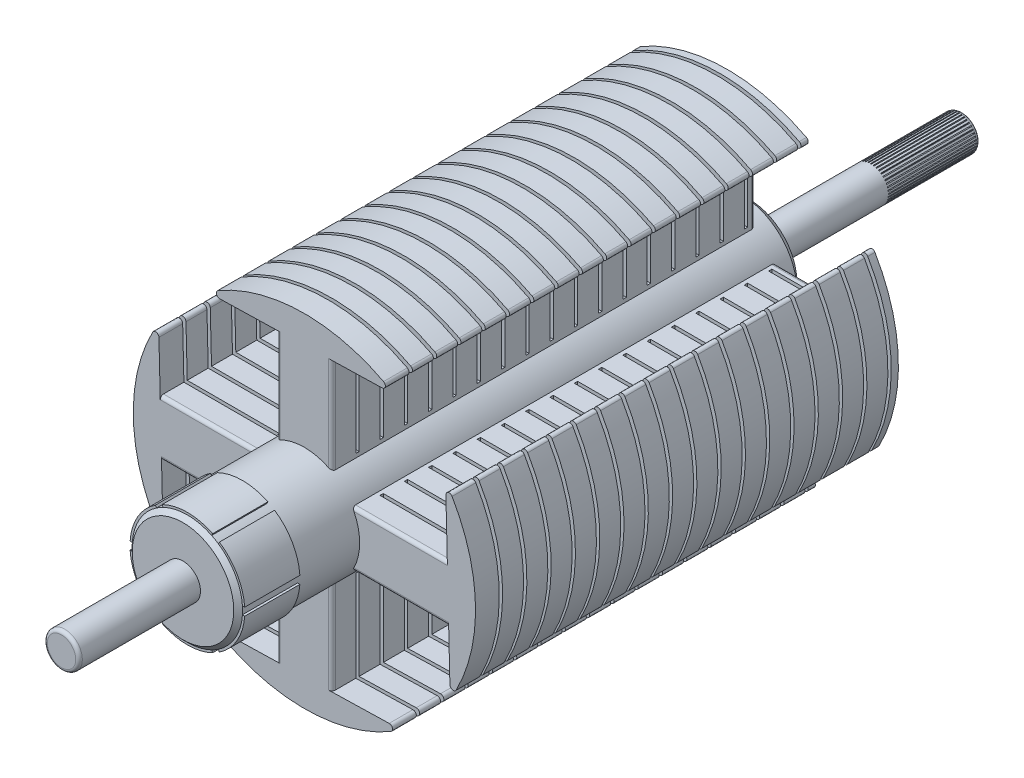
from build123d import *
from build123d.topology import SkipClean

# Parameters (mm, degrees)
BOSS_EXTRUDE1_DEPTH          = 38.3
FILLET1_R                    = 0.3
SKETCH2_W                    = 20
SKETCH2_H                    = 14
CUT_EXTRUDE1_DEPTH           = 0.3
LPATTERN1_COUNT              = 19
LPATTERN1_PITCH              = 2.2
CIRPATTERN1_COUNT            = 4
CIRPATTERN1_COPY_1_SKETCH_W  = 20
CIRPATTERN1_COPY_1_SKETCH_H  = 14
CIRPATTERN1_COPY_1_DEPTH     = 0.3
CIRPATTERN1_COPY_2_SKETCH_W  = 20
CIRPATTERN1_COPY_2_SKETCH_H  = 14
CIRPATTERN1_COPY_2_DEPTH     = 0.3
CIRPATTERN1_COPY_3_SKETCH_W  = 20
CIRPATTERN1_COPY_3_SKETCH_H  = 14
CIRPATTERN1_COPY_3_DEPTH     = 0.3
CIRPATTERN1_COPY_4_SKETCH_W  = 20
CIRPATTERN1_COPY_4_SKETCH_H  = 14
CIRPATTERN1_COPY_4_DEPTH     = 0.3
CIRPATTERN1_COPY_5_SKETCH_W  = 20
CIRPATTERN1_COPY_5_SKETCH_H  = 14
CIRPATTERN1_COPY_5_DEPTH     = 0.3
CIRPATTERN1_COPY_6_SKETCH_W  = 20
CIRPATTERN1_COPY_6_SKETCH_H  = 14
CIRPATTERN1_COPY_6_DEPTH     = 0.3
CIRPATTERN1_COPY_7_SKETCH_W  = 20
CIRPATTERN1_COPY_7_SKETCH_H  = 14
CIRPATTERN1_COPY_7_DEPTH     = 0.3
CIRPATTERN1_COPY_8_SKETCH_W  = 20
CIRPATTERN1_COPY_8_SKETCH_H  = 14
CIRPATTERN1_COPY_8_DEPTH     = 0.3
CIRPATTERN1_COPY_9_SKETCH_W  = 20
CIRPATTERN1_COPY_9_SKETCH_H  = 14
CIRPATTERN1_COPY_9_DEPTH     = 0.3
CIRPATTERN1_COPY_10_SKETCH_W = 20
CIRPATTERN1_COPY_10_SKETCH_H = 14
CIRPATTERN1_COPY_10_DEPTH    = 0.3
CIRPATTERN1_COPY_11_SKETCH_W = 20
CIRPATTERN1_COPY_11_SKETCH_H = 14
CIRPATTERN1_COPY_11_DEPTH    = 0.3
CIRPATTERN1_COPY_12_SKETCH_W = 20
CIRPATTERN1_COPY_12_SKETCH_H = 14
CIRPATTERN1_COPY_12_DEPTH    = 0.3
CIRPATTERN1_COPY_13_SKETCH_W = 20
CIRPATTERN1_COPY_13_SKETCH_H = 14
CIRPATTERN1_COPY_13_DEPTH    = 0.3
CIRPATTERN1_COPY_14_SKETCH_W = 20
CIRPATTERN1_COPY_14_SKETCH_H = 14
CIRPATTERN1_COPY_14_DEPTH    = 0.3
CIRPATTERN1_COPY_15_SKETCH_W = 20
CIRPATTERN1_COPY_15_SKETCH_H = 14
CIRPATTERN1_COPY_15_DEPTH    = 0.3
CIRPATTERN1_COPY_16_SKETCH_W = 20
CIRPATTERN1_COPY_16_SKETCH_H = 14
CIRPATTERN1_COPY_16_DEPTH    = 0.3
CIRPATTERN1_COPY_17_SKETCH_W = 20
CIRPATTERN1_COPY_17_SKETCH_H = 14
CIRPATTERN1_COPY_17_DEPTH    = 0.3
CIRPATTERN1_COPY_18_SKETCH_W = 20
CIRPATTERN1_COPY_18_SKETCH_H = 14
CIRPATTERN1_COPY_18_DEPTH    = 0.3
CIRPATTERN1_COPY_19_SKETCH_W = 20
CIRPATTERN1_COPY_19_SKETCH_H = 14
CIRPATTERN1_COPY_19_DEPTH    = 0.3
CIRPATTERN1_COPY_20_SKETCH_W = 20
CIRPATTERN1_COPY_20_SKETCH_H = 14
CIRPATTERN1_COPY_20_DEPTH    = 0.3
CIRPATTERN1_COPY_21_SKETCH_W = 20
CIRPATTERN1_COPY_21_SKETCH_H = 14
CIRPATTERN1_COPY_21_DEPTH    = 0.3
CIRPATTERN1_COPY_22_SKETCH_W = 20
CIRPATTERN1_COPY_22_SKETCH_H = 14
CIRPATTERN1_COPY_22_DEPTH    = 0.3
CIRPATTERN1_COPY_23_SKETCH_W = 20
CIRPATTERN1_COPY_23_SKETCH_H = 14
CIRPATTERN1_COPY_23_DEPTH    = 0.3
CIRPATTERN1_COPY_24_SKETCH_W = 20
CIRPATTERN1_COPY_24_SKETCH_H = 14
CIRPATTERN1_COPY_24_DEPTH    = 0.3
CIRPATTERN1_COPY_25_SKETCH_W = 20
CIRPATTERN1_COPY_25_SKETCH_H = 14
CIRPATTERN1_COPY_25_DEPTH    = 0.3
CIRPATTERN1_COPY_26_SKETCH_W = 20
CIRPATTERN1_COPY_26_SKETCH_H = 14
CIRPATTERN1_COPY_26_DEPTH    = 0.3
CIRPATTERN1_COPY_27_SKETCH_W = 20
CIRPATTERN1_COPY_27_SKETCH_H = 14
CIRPATTERN1_COPY_27_DEPTH    = 0.3
CIRPATTERN1_COPY_28_SKETCH_W = 20
CIRPATTERN1_COPY_28_SKETCH_H = 14
CIRPATTERN1_COPY_28_DEPTH    = 0.3
CIRPATTERN1_COPY_29_SKETCH_W = 20
CIRPATTERN1_COPY_29_SKETCH_H = 14
CIRPATTERN1_COPY_29_DEPTH    = 0.3
CIRPATTERN1_COPY_30_SKETCH_W = 20
CIRPATTERN1_COPY_30_SKETCH_H = 14
CIRPATTERN1_COPY_30_DEPTH    = 0.3
CIRPATTERN1_COPY_31_SKETCH_W = 20
CIRPATTERN1_COPY_31_SKETCH_H = 14
CIRPATTERN1_COPY_31_DEPTH    = 0.3
CIRPATTERN1_COPY_32_SKETCH_W = 20
CIRPATTERN1_COPY_32_SKETCH_H = 14
CIRPATTERN1_COPY_32_DEPTH    = 0.3
CIRPATTERN1_COPY_33_SKETCH_W = 20
CIRPATTERN1_COPY_33_SKETCH_H = 14
CIRPATTERN1_COPY_33_DEPTH    = 0.3
CIRPATTERN1_COPY_34_SKETCH_W = 20
CIRPATTERN1_COPY_34_SKETCH_H = 14
CIRPATTERN1_COPY_34_DEPTH    = 0.3
CIRPATTERN1_COPY_35_SKETCH_W = 20
CIRPATTERN1_COPY_35_SKETCH_H = 14
CIRPATTERN1_COPY_35_DEPTH    = 0.3
CIRPATTERN1_COPY_36_SKETCH_W = 20
CIRPATTERN1_COPY_36_SKETCH_H = 14
CIRPATTERN1_COPY_36_DEPTH    = 0.3
CIRPATTERN1_COPY_37_SKETCH_W = 20
CIRPATTERN1_COPY_37_SKETCH_H = 14
CIRPATTERN1_COPY_37_DEPTH    = 0.3
CIRPATTERN1_COPY_38_SKETCH_W = 20
CIRPATTERN1_COPY_38_SKETCH_H = 14
CIRPATTERN1_COPY_38_DEPTH    = 0.3
CIRPATTERN1_COPY_39_SKETCH_W = 20
CIRPATTERN1_COPY_39_SKETCH_H = 14
CIRPATTERN1_COPY_39_DEPTH    = 0.3
CIRPATTERN1_COPY_40_SKETCH_W = 20
CIRPATTERN1_COPY_40_SKETCH_H = 14
CIRPATTERN1_COPY_40_DEPTH    = 0.3
CIRPATTERN1_COPY_41_SKETCH_W = 20
CIRPATTERN1_COPY_41_SKETCH_H = 14
CIRPATTERN1_COPY_41_DEPTH    = 0.3
CIRPATTERN1_COPY_42_SKETCH_W = 20
CIRPATTERN1_COPY_42_SKETCH_H = 14
CIRPATTERN1_COPY_42_DEPTH    = 0.3
CIRPATTERN1_COPY_43_SKETCH_W = 20
CIRPATTERN1_COPY_43_SKETCH_H = 14
CIRPATTERN1_COPY_43_DEPTH    = 0.3
CIRPATTERN1_COPY_44_SKETCH_W = 20
CIRPATTERN1_COPY_44_SKETCH_H = 14
CIRPATTERN1_COPY_44_DEPTH    = 0.3
CIRPATTERN1_COPY_45_SKETCH_W = 20
CIRPATTERN1_COPY_45_SKETCH_H = 14
CIRPATTERN1_COPY_45_DEPTH    = 0.3
CIRPATTERN1_COPY_46_SKETCH_W = 20
CIRPATTERN1_COPY_46_SKETCH_H = 14
CIRPATTERN1_COPY_46_DEPTH    = 0.3
CIRPATTERN1_COPY_47_SKETCH_W = 20
CIRPATTERN1_COPY_47_SKETCH_H = 14
CIRPATTERN1_COPY_47_DEPTH    = 0.3
CIRPATTERN1_COPY_48_SKETCH_W = 20
CIRPATTERN1_COPY_48_SKETCH_H = 14
CIRPATTERN1_COPY_48_DEPTH    = 0.3
CIRPATTERN1_COPY_49_SKETCH_W = 20
CIRPATTERN1_COPY_49_SKETCH_H = 14
CIRPATTERN1_COPY_49_DEPTH    = 0.3
CIRPATTERN1_COPY_50_SKETCH_W = 20
CIRPATTERN1_COPY_50_SKETCH_H = 14
CIRPATTERN1_COPY_50_DEPTH    = 0.3
CIRPATTERN1_COPY_51_SKETCH_W = 20
CIRPATTERN1_COPY_51_SKETCH_H = 14
CIRPATTERN1_COPY_51_DEPTH    = 0.3
CIRPATTERN1_COPY_52_SKETCH_W = 20
CIRPATTERN1_COPY_52_SKETCH_H = 14
CIRPATTERN1_COPY_52_DEPTH    = 0.3
CIRPATTERN1_COPY_53_SKETCH_W = 20
CIRPATTERN1_COPY_53_SKETCH_H = 14
CIRPATTERN1_COPY_53_DEPTH    = 0.3
CIRPATTERN1_COPY_54_SKETCH_W = 20
CIRPATTERN1_COPY_54_SKETCH_H = 14
CIRPATTERN1_COPY_54_DEPTH    = 0.3
BOSS_EXTRUDE2_START          = 2
SKETCH3_R                    = 5
BOSS_EXTRUDE2_DEPTH          = 2
CHAMFER1_SIZE                = 0.7
SKETCH4_R                    = 1.585
BOSS_EXTRUDE3_DEPTH          = 19.3
FILLET2_R                    = 0.3
SKETCH5_R                    = 5
BOSS_EXTRUDE4_DEPTH          = 11
CHAMFER2_SIZE                = 0.4
BOSS_EXTRUDE6_START          = -5
BOSS_EXTRUDE6_DEPTH          = 5
SKETCH9_W                    = 0.08
SKETCH9_H                    = 0.4
SKETCH9_W_2                  = 0.4
SKETCH9_H_2                  = 0.08
CUT_EXTRUDE2_DEPTH           = 8
BOSS_EXTRUDE7_START          = 11
SKETCH10_R                   = 1.585
BOSS_EXTRUDE7_DEPTH          = 11
FILLET3_R                    = 0.3


with BuildPart() as part:
    # Sketch1 → Boss-Extrude1 (new body)
    with BuildSketch(Plane.XY):
        with BuildLine():
            Line((-8.758733901, 12.788063983), (-2.5, 12.942328551))
            Line((-2.5, 12.942328551), (-2.5, 4.330127019))
            ThreePointArc((-2.5, 4.330127019), (-3.535533906, 3.535533906), (-4.330127019, 2.5))
            Line((-4.330127019, 2.5), (-13.065567988, 2.5))
            Line((-13.065567988, 2.5), (-13.204041875, 8.118083405))
            ThreePointArc((-13.204041875, 8.118083405), (-15.495293877, -0.381926258), (-12.788063983, -8.758733901))
            Line((-12.788063983, -8.758733901), (-12.942328551, -2.5))
            Line((-12.942328551, -2.5), (-4.330127019, -2.5))
            ThreePointArc((-4.330127019, -2.5), (-3.535533906, -3.535533906), (-2.5, -4.330127019))
            Line((-2.5, -4.330127019), (-2.5, -13.065567988))
            Line((-2.5, -13.065567988), (-8.118083405, -13.204041875))
            ThreePointArc((-8.118083405, -13.204041875), (0.381926258, -15.495293877), (8.758733901, -12.788063983))
            Line((8.758733901, -12.788063983), (2.5, -12.942328551))
            Line((2.5, -12.942328551), (2.5, -4.330127019))
            ThreePointArc((2.5, -4.330127019), (3.535533906, -3.535533906), (4.330127019, -2.5))
            Line((4.330127019, -2.5), (13.065567988, -2.5))
            Line((13.065567988, -2.5), (13.204041875, -8.118083405))
            ThreePointArc((13.204041875, -8.118083405), (15.495293877, 0.381926258), (12.788063983, 8.758733901))
            Line((12.788063983, 8.758733901), (12.942328551, 2.5))
            Line((12.942328551, 2.5), (4.330127019, 2.5))
            ThreePointArc((4.330127019, 2.5), (3.535533906, 3.535533906), (2.5, 4.330127019))
            Line((2.5, 4.330127019), (2.5, 13.065567988))
            Line((2.5, 13.065567988), (8.118083405, 13.204041875))
            ThreePointArc((8.118083405, 13.204041875), (-0.381926258, 15.495293877), (-8.758733901, 12.788063983))
        make_face()
    extrude(amount=BOSS_EXTRUDE1_DEPTH)

    # Fillet1
    fillet1_edges = [part.edges().sort_by_distance(p)[0] for p in [
        (8.636227785, 2.5, 0),
        (8.697847503, -2.5, 0),
        (2.5, -8.636227785, 0),
        (-2.5, -8.697847503, 0),
        (-8.636227785, -2.5, 0),
        (-8.697847503, 2.5, 0),
        (13.204041875, -8.118083405, 19.15),
        (8.758733901, -12.788063983, 19.15),
        (-8.118083405, -13.204041875, 19.15),
        (-12.788063983, -8.758733901, 19.15),
        (-13.204041875, 8.118083405, 19.15),
        (-8.697847503, 2.5, 38.3),
        (-8.636227785, -2.5, 38.3),
        (-2.5, -8.697847503, 38.3),
        (2.5, -8.636227785, 38.3),
        (8.697847503, -2.5, 38.3),
        (8.636227785, 2.5, 38.3),
        (12.788063983, 8.758733901, 19.15),
        (2.5, 8.697847503, 0),
        (-2.5, 8.636227785, 0),
        (-8.758733901, 12.788063983, 19.15),
        (8.118083405, 13.204041875, 19.15),
        (-2.5, 8.636227785, 38.3),
        (2.5, 8.697847503, 38.3),
    ]]
    fillet(fillet1_edges, radius=FILLET1_R)

    # Sketch2 → Cut-Extrude1 (cut)
    with BuildSketch(Plane.XY.offset(36.15)):
        with Locations((0, 11.692424815)):
            Rectangle(SKETCH2_W, SKETCH2_H)
    cut_extrude1 = extrude(amount=-CUT_EXTRUDE1_DEPTH, mode=Mode.SUBTRACT)

    # LPattern1: Cut-Extrude1 ×19
    with Locations(*[(0, 0, -i * LPATTERN1_PITCH) for i in range(1, LPATTERN1_COUNT)]):
        add(cut_extrude1, mode=Mode.SUBTRACT)

    # CirPattern1: Cut-Extrude1 ×4 about axis
    cirpattern1_axis = Axis((0, 0, 38.3), (0, 0, -1))
    for i in range(1, CIRPATTERN1_COUNT):
        add(cut_extrude1.rotate(cirpattern1_axis, i * 360 / CIRPATTERN1_COUNT), mode=Mode.SUBTRACT)

    # CirPattern1 copy 1 sketch → CirPattern1 copy 1 (cut)
    with BuildSketch(Plane(origin=(0, 0, 33.95), x_dir=(0, -1, 0), z_dir=(0, 0, 1))):
        with Locations((0, 11.692424815)):
            Rectangle(CIRPATTERN1_COPY_1_SKETCH_W, CIRPATTERN1_COPY_1_SKETCH_H)
    extrude(amount=-CIRPATTERN1_COPY_1_DEPTH, mode=Mode.SUBTRACT)

    # CirPattern1 copy 2 sketch → CirPattern1 copy 2 (cut)
    with BuildSketch(Plane(origin=(0, 0, 33.95), x_dir=(-1, 0, 0), z_dir=(0, 0, 1))):
        with Locations((0, 11.692424815)):
            Rectangle(CIRPATTERN1_COPY_2_SKETCH_W, CIRPATTERN1_COPY_2_SKETCH_H)
    extrude(amount=-CIRPATTERN1_COPY_2_DEPTH, mode=Mode.SUBTRACT)

    # CirPattern1 copy 3 sketch → CirPattern1 copy 3 (cut)
    with BuildSketch(Plane(origin=(0, 0, 33.95), x_dir=(0, 1, 0), z_dir=(0, 0, 1))):
        with Locations((0, 11.692424815)):
            Rectangle(CIRPATTERN1_COPY_3_SKETCH_W, CIRPATTERN1_COPY_3_SKETCH_H)
    extrude(amount=-CIRPATTERN1_COPY_3_DEPTH, mode=Mode.SUBTRACT)

    # CirPattern1 copy 4 sketch → CirPattern1 copy 4 (cut)
    with BuildSketch(Plane(origin=(0, 0, 31.75), x_dir=(0, -1, 0), z_dir=(0, 0, 1))):
        with Locations((0, 11.692424815)):
            Rectangle(CIRPATTERN1_COPY_4_SKETCH_W, CIRPATTERN1_COPY_4_SKETCH_H)
    extrude(amount=-CIRPATTERN1_COPY_4_DEPTH, mode=Mode.SUBTRACT)

    # CirPattern1 copy 5 sketch → CirPattern1 copy 5 (cut)
    with BuildSketch(Plane(origin=(0, 0, 31.75), x_dir=(-1, 0, 0), z_dir=(0, 0, 1))):
        with Locations((0, 11.692424815)):
            Rectangle(CIRPATTERN1_COPY_5_SKETCH_W, CIRPATTERN1_COPY_5_SKETCH_H)
    extrude(amount=-CIRPATTERN1_COPY_5_DEPTH, mode=Mode.SUBTRACT)

    # CirPattern1 copy 6 sketch → CirPattern1 copy 6 (cut)
    with BuildSketch(Plane(origin=(0, 0, 31.75), x_dir=(0, 1, 0), z_dir=(0, 0, 1))):
        with Locations((0, 11.692424815)):
            Rectangle(CIRPATTERN1_COPY_6_SKETCH_W, CIRPATTERN1_COPY_6_SKETCH_H)
    extrude(amount=-CIRPATTERN1_COPY_6_DEPTH, mode=Mode.SUBTRACT)

    # CirPattern1 copy 7 sketch → CirPattern1 copy 7 (cut)
    with BuildSketch(Plane(origin=(0, 0, 29.55), x_dir=(0, -1, 0), z_dir=(0, 0, 1))):
        with Locations((0, 11.692424815)):
            Rectangle(CIRPATTERN1_COPY_7_SKETCH_W, CIRPATTERN1_COPY_7_SKETCH_H)
    extrude(amount=-CIRPATTERN1_COPY_7_DEPTH, mode=Mode.SUBTRACT)

    # CirPattern1 copy 8 sketch → CirPattern1 copy 8 (cut)
    with BuildSketch(Plane(origin=(0, 0, 29.55), x_dir=(-1, 0, 0), z_dir=(0, 0, 1))):
        with Locations((0, 11.692424815)):
            Rectangle(CIRPATTERN1_COPY_8_SKETCH_W, CIRPATTERN1_COPY_8_SKETCH_H)
    extrude(amount=-CIRPATTERN1_COPY_8_DEPTH, mode=Mode.SUBTRACT)

    # CirPattern1 copy 9 sketch → CirPattern1 copy 9 (cut)
    with BuildSketch(Plane(origin=(0, 0, 29.55), x_dir=(0, 1, 0), z_dir=(0, 0, 1))):
        with Locations((0, 11.692424815)):
            Rectangle(CIRPATTERN1_COPY_9_SKETCH_W, CIRPATTERN1_COPY_9_SKETCH_H)
    extrude(amount=-CIRPATTERN1_COPY_9_DEPTH, mode=Mode.SUBTRACT)

    # CirPattern1 copy 10 sketch → CirPattern1 copy 10 (cut)
    with BuildSketch(Plane(origin=(0, 0, 27.35), x_dir=(0, -1, 0), z_dir=(0, 0, 1))):
        with Locations((0, 11.692424815)):
            Rectangle(CIRPATTERN1_COPY_10_SKETCH_W, CIRPATTERN1_COPY_10_SKETCH_H)
    extrude(amount=-CIRPATTERN1_COPY_10_DEPTH, mode=Mode.SUBTRACT)

    # CirPattern1 copy 11 sketch → CirPattern1 copy 11 (cut)
    with BuildSketch(Plane(origin=(0, 0, 27.35), x_dir=(-1, 0, 0), z_dir=(0, 0, 1))):
        with Locations((0, 11.692424815)):
            Rectangle(CIRPATTERN1_COPY_11_SKETCH_W, CIRPATTERN1_COPY_11_SKETCH_H)
    extrude(amount=-CIRPATTERN1_COPY_11_DEPTH, mode=Mode.SUBTRACT)

    # CirPattern1 copy 12 sketch → CirPattern1 copy 12 (cut)
    with BuildSketch(Plane(origin=(0, 0, 27.35), x_dir=(0, 1, 0), z_dir=(0, 0, 1))):
        with Locations((0, 11.692424815)):
            Rectangle(CIRPATTERN1_COPY_12_SKETCH_W, CIRPATTERN1_COPY_12_SKETCH_H)
    extrude(amount=-CIRPATTERN1_COPY_12_DEPTH, mode=Mode.SUBTRACT)

    # CirPattern1 copy 13 sketch → CirPattern1 copy 13 (cut)
    with BuildSketch(Plane(origin=(0, 0, 25.15), x_dir=(0, -1, 0), z_dir=(0, 0, 1))):
        with Locations((0, 11.692424815)):
            Rectangle(CIRPATTERN1_COPY_13_SKETCH_W, CIRPATTERN1_COPY_13_SKETCH_H)
    extrude(amount=-CIRPATTERN1_COPY_13_DEPTH, mode=Mode.SUBTRACT)

    # CirPattern1 copy 14 sketch → CirPattern1 copy 14 (cut)
    with BuildSketch(Plane(origin=(0, 0, 25.15), x_dir=(-1, 0, 0), z_dir=(0, 0, 1))):
        with Locations((0, 11.692424815)):
            Rectangle(CIRPATTERN1_COPY_14_SKETCH_W, CIRPATTERN1_COPY_14_SKETCH_H)
    extrude(amount=-CIRPATTERN1_COPY_14_DEPTH, mode=Mode.SUBTRACT)

    # CirPattern1 copy 15 sketch → CirPattern1 copy 15 (cut)
    with BuildSketch(Plane(origin=(0, 0, 25.15), x_dir=(0, 1, 0), z_dir=(0, 0, 1))):
        with Locations((0, 11.692424815)):
            Rectangle(CIRPATTERN1_COPY_15_SKETCH_W, CIRPATTERN1_COPY_15_SKETCH_H)
    extrude(amount=-CIRPATTERN1_COPY_15_DEPTH, mode=Mode.SUBTRACT)

    # CirPattern1 copy 16 sketch → CirPattern1 copy 16 (cut)
    with BuildSketch(Plane(origin=(0, 0, 22.95), x_dir=(0, -1, 0), z_dir=(0, 0, 1))):
        with Locations((0, 11.692424815)):
            Rectangle(CIRPATTERN1_COPY_16_SKETCH_W, CIRPATTERN1_COPY_16_SKETCH_H)
    extrude(amount=-CIRPATTERN1_COPY_16_DEPTH, mode=Mode.SUBTRACT)

    # CirPattern1 copy 17 sketch → CirPattern1 copy 17 (cut)
    with BuildSketch(Plane(origin=(0, 0, 22.95), x_dir=(-1, 0, 0), z_dir=(0, 0, 1))):
        with Locations((0, 11.692424815)):
            Rectangle(CIRPATTERN1_COPY_17_SKETCH_W, CIRPATTERN1_COPY_17_SKETCH_H)
    extrude(amount=-CIRPATTERN1_COPY_17_DEPTH, mode=Mode.SUBTRACT)

    # CirPattern1 copy 18 sketch → CirPattern1 copy 18 (cut)
    with BuildSketch(Plane(origin=(0, 0, 22.95), x_dir=(0, 1, 0), z_dir=(0, 0, 1))):
        with Locations((0, 11.692424815)):
            Rectangle(CIRPATTERN1_COPY_18_SKETCH_W, CIRPATTERN1_COPY_18_SKETCH_H)
    extrude(amount=-CIRPATTERN1_COPY_18_DEPTH, mode=Mode.SUBTRACT)

    # CirPattern1 copy 19 sketch → CirPattern1 copy 19 (cut)
    with BuildSketch(Plane(origin=(0, 0, 20.75), x_dir=(0, -1, 0), z_dir=(0, 0, 1))):
        with Locations((0, 11.692424815)):
            Rectangle(CIRPATTERN1_COPY_19_SKETCH_W, CIRPATTERN1_COPY_19_SKETCH_H)
    extrude(amount=-CIRPATTERN1_COPY_19_DEPTH, mode=Mode.SUBTRACT)

    # CirPattern1 copy 20 sketch → CirPattern1 copy 20 (cut)
    with BuildSketch(Plane(origin=(0, 0, 20.75), x_dir=(-1, 0, 0), z_dir=(0, 0, 1))):
        with Locations((0, 11.692424815)):
            Rectangle(CIRPATTERN1_COPY_20_SKETCH_W, CIRPATTERN1_COPY_20_SKETCH_H)
    extrude(amount=-CIRPATTERN1_COPY_20_DEPTH, mode=Mode.SUBTRACT)

    # CirPattern1 copy 21 sketch → CirPattern1 copy 21 (cut)
    with BuildSketch(Plane(origin=(0, 0, 20.75), x_dir=(0, 1, 0), z_dir=(0, 0, 1))):
        with Locations((0, 11.692424815)):
            Rectangle(CIRPATTERN1_COPY_21_SKETCH_W, CIRPATTERN1_COPY_21_SKETCH_H)
    extrude(amount=-CIRPATTERN1_COPY_21_DEPTH, mode=Mode.SUBTRACT)

    # CirPattern1 copy 22 sketch → CirPattern1 copy 22 (cut)
    with BuildSketch(Plane(origin=(0, 0, 18.55), x_dir=(0, -1, 0), z_dir=(0, 0, 1))):
        with Locations((0, 11.692424815)):
            Rectangle(CIRPATTERN1_COPY_22_SKETCH_W, CIRPATTERN1_COPY_22_SKETCH_H)
    extrude(amount=-CIRPATTERN1_COPY_22_DEPTH, mode=Mode.SUBTRACT)

    # CirPattern1 copy 23 sketch → CirPattern1 copy 23 (cut)
    with BuildSketch(Plane(origin=(0, 0, 18.55), x_dir=(-1, 0, 0), z_dir=(0, 0, 1))):
        with Locations((0, 11.692424815)):
            Rectangle(CIRPATTERN1_COPY_23_SKETCH_W, CIRPATTERN1_COPY_23_SKETCH_H)
    extrude(amount=-CIRPATTERN1_COPY_23_DEPTH, mode=Mode.SUBTRACT)

    # CirPattern1 copy 24 sketch → CirPattern1 copy 24 (cut)
    with BuildSketch(Plane(origin=(0, 0, 18.55), x_dir=(0, 1, 0), z_dir=(0, 0, 1))):
        with Locations((0, 11.692424815)):
            Rectangle(CIRPATTERN1_COPY_24_SKETCH_W, CIRPATTERN1_COPY_24_SKETCH_H)
    extrude(amount=-CIRPATTERN1_COPY_24_DEPTH, mode=Mode.SUBTRACT)

    # CirPattern1 copy 25 sketch → CirPattern1 copy 25 (cut)
    with BuildSketch(Plane(origin=(0, 0, 16.35), x_dir=(0, -1, 0), z_dir=(0, 0, 1))):
        with Locations((0, 11.692424815)):
            Rectangle(CIRPATTERN1_COPY_25_SKETCH_W, CIRPATTERN1_COPY_25_SKETCH_H)
    extrude(amount=-CIRPATTERN1_COPY_25_DEPTH, mode=Mode.SUBTRACT)

    # CirPattern1 copy 26 sketch → CirPattern1 copy 26 (cut)
    with BuildSketch(Plane(origin=(0, 0, 16.35), x_dir=(-1, 0, 0), z_dir=(0, 0, 1))):
        with Locations((0, 11.692424815)):
            Rectangle(CIRPATTERN1_COPY_26_SKETCH_W, CIRPATTERN1_COPY_26_SKETCH_H)
    extrude(amount=-CIRPATTERN1_COPY_26_DEPTH, mode=Mode.SUBTRACT)

    # CirPattern1 copy 27 sketch → CirPattern1 copy 27 (cut)
    with BuildSketch(Plane(origin=(0, 0, 16.35), x_dir=(0, 1, 0), z_dir=(0, 0, 1))):
        with Locations((0, 11.692424815)):
            Rectangle(CIRPATTERN1_COPY_27_SKETCH_W, CIRPATTERN1_COPY_27_SKETCH_H)
    extrude(amount=-CIRPATTERN1_COPY_27_DEPTH, mode=Mode.SUBTRACT)

    # CirPattern1 copy 28 sketch → CirPattern1 copy 28 (cut)
    with BuildSketch(Plane(origin=(0, 0, 14.15), x_dir=(0, -1, 0), z_dir=(0, 0, 1))):
        with Locations((0, 11.692424815)):
            Rectangle(CIRPATTERN1_COPY_28_SKETCH_W, CIRPATTERN1_COPY_28_SKETCH_H)
    extrude(amount=-CIRPATTERN1_COPY_28_DEPTH, mode=Mode.SUBTRACT)

    # CirPattern1 copy 29 sketch → CirPattern1 copy 29 (cut)
    with BuildSketch(Plane(origin=(0, 0, 14.15), x_dir=(-1, 0, 0), z_dir=(0, 0, 1))):
        with Locations((0, 11.692424815)):
            Rectangle(CIRPATTERN1_COPY_29_SKETCH_W, CIRPATTERN1_COPY_29_SKETCH_H)
    extrude(amount=-CIRPATTERN1_COPY_29_DEPTH, mode=Mode.SUBTRACT)

    # CirPattern1 copy 30 sketch → CirPattern1 copy 30 (cut)
    with BuildSketch(Plane(origin=(0, 0, 14.15), x_dir=(0, 1, 0), z_dir=(0, 0, 1))):
        with Locations((0, 11.692424815)):
            Rectangle(CIRPATTERN1_COPY_30_SKETCH_W, CIRPATTERN1_COPY_30_SKETCH_H)
    extrude(amount=-CIRPATTERN1_COPY_30_DEPTH, mode=Mode.SUBTRACT)

    # CirPattern1 copy 31 sketch → CirPattern1 copy 31 (cut)
    with BuildSketch(Plane(origin=(0, 0, 11.95), x_dir=(0, -1, 0), z_dir=(0, 0, 1))):
        with Locations((0, 11.692424815)):
            Rectangle(CIRPATTERN1_COPY_31_SKETCH_W, CIRPATTERN1_COPY_31_SKETCH_H)
    extrude(amount=-CIRPATTERN1_COPY_31_DEPTH, mode=Mode.SUBTRACT)

    # CirPattern1 copy 32 sketch → CirPattern1 copy 32 (cut)
    with BuildSketch(Plane(origin=(0, 0, 11.95), x_dir=(-1, 0, 0), z_dir=(0, 0, 1))):
        with Locations((0, 11.692424815)):
            Rectangle(CIRPATTERN1_COPY_32_SKETCH_W, CIRPATTERN1_COPY_32_SKETCH_H)
    extrude(amount=-CIRPATTERN1_COPY_32_DEPTH, mode=Mode.SUBTRACT)

    # CirPattern1 copy 33 sketch → CirPattern1 copy 33 (cut)
    with BuildSketch(Plane(origin=(0, 0, 11.95), x_dir=(0, 1, 0), z_dir=(0, 0, 1))):
        with Locations((0, 11.692424815)):
            Rectangle(CIRPATTERN1_COPY_33_SKETCH_W, CIRPATTERN1_COPY_33_SKETCH_H)
    extrude(amount=-CIRPATTERN1_COPY_33_DEPTH, mode=Mode.SUBTRACT)

    # CirPattern1 copy 34 sketch → CirPattern1 copy 34 (cut)
    with BuildSketch(Plane(origin=(0, 0, 9.75), x_dir=(0, -1, 0), z_dir=(0, 0, 1))):
        with Locations((0, 11.692424815)):
            Rectangle(CIRPATTERN1_COPY_34_SKETCH_W, CIRPATTERN1_COPY_34_SKETCH_H)
    extrude(amount=-CIRPATTERN1_COPY_34_DEPTH, mode=Mode.SUBTRACT)

    # CirPattern1 copy 35 sketch → CirPattern1 copy 35 (cut)
    with BuildSketch(Plane(origin=(0, 0, 9.75), x_dir=(-1, 0, 0), z_dir=(0, 0, 1))):
        with Locations((0, 11.692424815)):
            Rectangle(CIRPATTERN1_COPY_35_SKETCH_W, CIRPATTERN1_COPY_35_SKETCH_H)
    extrude(amount=-CIRPATTERN1_COPY_35_DEPTH, mode=Mode.SUBTRACT)

    # CirPattern1 copy 36 sketch → CirPattern1 copy 36 (cut)
    with BuildSketch(Plane(origin=(0, 0, 9.75), x_dir=(0, 1, 0), z_dir=(0, 0, 1))):
        with Locations((0, 11.692424815)):
            Rectangle(CIRPATTERN1_COPY_36_SKETCH_W, CIRPATTERN1_COPY_36_SKETCH_H)
    extrude(amount=-CIRPATTERN1_COPY_36_DEPTH, mode=Mode.SUBTRACT)

    # CirPattern1 copy 37 sketch → CirPattern1 copy 37 (cut)
    with BuildSketch(Plane(origin=(0, 0, 7.55), x_dir=(0, -1, 0), z_dir=(0, 0, 1))):
        with Locations((0, 11.692424815)):
            Rectangle(CIRPATTERN1_COPY_37_SKETCH_W, CIRPATTERN1_COPY_37_SKETCH_H)
    extrude(amount=-CIRPATTERN1_COPY_37_DEPTH, mode=Mode.SUBTRACT)

    # CirPattern1 copy 38 sketch → CirPattern1 copy 38 (cut)
    with BuildSketch(Plane(origin=(0, 0, 7.55), x_dir=(-1, 0, 0), z_dir=(0, 0, 1))):
        with Locations((0, 11.692424815)):
            Rectangle(CIRPATTERN1_COPY_38_SKETCH_W, CIRPATTERN1_COPY_38_SKETCH_H)
    extrude(amount=-CIRPATTERN1_COPY_38_DEPTH, mode=Mode.SUBTRACT)

    # CirPattern1 copy 39 sketch → CirPattern1 copy 39 (cut)
    with BuildSketch(Plane(origin=(0, 0, 7.55), x_dir=(0, 1, 0), z_dir=(0, 0, 1))):
        with Locations((0, 11.692424815)):
            Rectangle(CIRPATTERN1_COPY_39_SKETCH_W, CIRPATTERN1_COPY_39_SKETCH_H)
    extrude(amount=-CIRPATTERN1_COPY_39_DEPTH, mode=Mode.SUBTRACT)

    # CirPattern1 copy 40 sketch → CirPattern1 copy 40 (cut)
    with BuildSketch(Plane(origin=(0, 0, 5.35), x_dir=(0, -1, 0), z_dir=(0, 0, 1))):
        with Locations((0, 11.692424815)):
            Rectangle(CIRPATTERN1_COPY_40_SKETCH_W, CIRPATTERN1_COPY_40_SKETCH_H)
    extrude(amount=-CIRPATTERN1_COPY_40_DEPTH, mode=Mode.SUBTRACT)

    # CirPattern1 copy 41 sketch → CirPattern1 copy 41 (cut)
    with BuildSketch(Plane(origin=(0, 0, 5.35), x_dir=(-1, 0, 0), z_dir=(0, 0, 1))):
        with Locations((0, 11.692424815)):
            Rectangle(CIRPATTERN1_COPY_41_SKETCH_W, CIRPATTERN1_COPY_41_SKETCH_H)
    extrude(amount=-CIRPATTERN1_COPY_41_DEPTH, mode=Mode.SUBTRACT)

    # CirPattern1 copy 42 sketch → CirPattern1 copy 42 (cut)
    with BuildSketch(Plane(origin=(0, 0, 5.35), x_dir=(0, 1, 0), z_dir=(0, 0, 1))):
        with Locations((0, 11.692424815)):
            Rectangle(CIRPATTERN1_COPY_42_SKETCH_W, CIRPATTERN1_COPY_42_SKETCH_H)
    extrude(amount=-CIRPATTERN1_COPY_42_DEPTH, mode=Mode.SUBTRACT)

    # CirPattern1 copy 43 sketch → CirPattern1 copy 43 (cut)
    with BuildSketch(Plane(origin=(0, 0, 3.15), x_dir=(0, -1, 0), z_dir=(0, 0, 1))):
        with Locations((0, 11.692424815)):
            Rectangle(CIRPATTERN1_COPY_43_SKETCH_W, CIRPATTERN1_COPY_43_SKETCH_H)
    extrude(amount=-CIRPATTERN1_COPY_43_DEPTH, mode=Mode.SUBTRACT)

    # CirPattern1 copy 44 sketch → CirPattern1 copy 44 (cut)
    with BuildSketch(Plane(origin=(0, 0, 3.15), x_dir=(-1, 0, 0), z_dir=(0, 0, 1))):
        with Locations((0, 11.692424815)):
            Rectangle(CIRPATTERN1_COPY_44_SKETCH_W, CIRPATTERN1_COPY_44_SKETCH_H)
    extrude(amount=-CIRPATTERN1_COPY_44_DEPTH, mode=Mode.SUBTRACT)

    # CirPattern1 copy 45 sketch → CirPattern1 copy 45 (cut)
    with BuildSketch(Plane(origin=(0, 0, 3.15), x_dir=(0, 1, 0), z_dir=(0, 0, 1))):
        with Locations((0, 11.692424815)):
            Rectangle(CIRPATTERN1_COPY_45_SKETCH_W, CIRPATTERN1_COPY_45_SKETCH_H)
    extrude(amount=-CIRPATTERN1_COPY_45_DEPTH, mode=Mode.SUBTRACT)

    # CirPattern1 copy 46 sketch → CirPattern1 copy 46 (cut)
    with BuildSketch(Plane(origin=(0, 0, 0.95), x_dir=(0, -1, 0), z_dir=(0, 0, 1))):
        with Locations((0, 11.692424815)):
            Rectangle(CIRPATTERN1_COPY_46_SKETCH_W, CIRPATTERN1_COPY_46_SKETCH_H)
    extrude(amount=-CIRPATTERN1_COPY_46_DEPTH, mode=Mode.SUBTRACT)

    # CirPattern1 copy 47 sketch → CirPattern1 copy 47 (cut)
    with BuildSketch(Plane(origin=(0, 0, 0.95), x_dir=(-1, 0, 0), z_dir=(0, 0, 1))):
        with Locations((0, 11.692424815)):
            Rectangle(CIRPATTERN1_COPY_47_SKETCH_W, CIRPATTERN1_COPY_47_SKETCH_H)
    extrude(amount=-CIRPATTERN1_COPY_47_DEPTH, mode=Mode.SUBTRACT)

    # CirPattern1 copy 48 sketch → CirPattern1 copy 48 (cut)
    with BuildSketch(Plane(origin=(0, 0, 0.95), x_dir=(0, 1, 0), z_dir=(0, 0, 1))):
        with Locations((0, 11.692424815)):
            Rectangle(CIRPATTERN1_COPY_48_SKETCH_W, CIRPATTERN1_COPY_48_SKETCH_H)
    extrude(amount=-CIRPATTERN1_COPY_48_DEPTH, mode=Mode.SUBTRACT)

    # CirPattern1 copy 49 sketch → CirPattern1 copy 49 (cut)
    with BuildSketch(Plane(origin=(0, 0, -1.25), x_dir=(0, -1, 0), z_dir=(0, 0, 1))):
        with Locations((0, 11.692424815)):
            Rectangle(CIRPATTERN1_COPY_49_SKETCH_W, CIRPATTERN1_COPY_49_SKETCH_H)
    extrude(amount=-CIRPATTERN1_COPY_49_DEPTH, mode=Mode.SUBTRACT)

    # CirPattern1 copy 50 sketch → CirPattern1 copy 50 (cut)
    with BuildSketch(Plane(origin=(0, 0, -1.25), x_dir=(-1, 0, 0), z_dir=(0, 0, 1))):
        with Locations((0, 11.692424815)):
            Rectangle(CIRPATTERN1_COPY_50_SKETCH_W, CIRPATTERN1_COPY_50_SKETCH_H)
    extrude(amount=-CIRPATTERN1_COPY_50_DEPTH, mode=Mode.SUBTRACT)

    # CirPattern1 copy 51 sketch → CirPattern1 copy 51 (cut)
    with BuildSketch(Plane(origin=(0, 0, -1.25), x_dir=(0, 1, 0), z_dir=(0, 0, 1))):
        with Locations((0, 11.692424815)):
            Rectangle(CIRPATTERN1_COPY_51_SKETCH_W, CIRPATTERN1_COPY_51_SKETCH_H)
    extrude(amount=-CIRPATTERN1_COPY_51_DEPTH, mode=Mode.SUBTRACT)

    # CirPattern1 copy 52 sketch → CirPattern1 copy 52 (cut)
    with BuildSketch(Plane(origin=(0, 0, -3.45), x_dir=(0, -1, 0), z_dir=(0, 0, 1))):
        with Locations((0, 11.692424815)):
            Rectangle(CIRPATTERN1_COPY_52_SKETCH_W, CIRPATTERN1_COPY_52_SKETCH_H)
    extrude(amount=-CIRPATTERN1_COPY_52_DEPTH, mode=Mode.SUBTRACT)

    # CirPattern1 copy 53 sketch → CirPattern1 copy 53 (cut)
    with BuildSketch(Plane(origin=(0, 0, -3.45), x_dir=(-1, 0, 0), z_dir=(0, 0, 1))):
        with Locations((0, 11.692424815)):
            Rectangle(CIRPATTERN1_COPY_53_SKETCH_W, CIRPATTERN1_COPY_53_SKETCH_H)
    extrude(amount=-CIRPATTERN1_COPY_53_DEPTH, mode=Mode.SUBTRACT)

    # CirPattern1 copy 54 sketch → CirPattern1 copy 54 (cut)
    with BuildSketch(Plane(origin=(0, 0, -3.45), x_dir=(0, 1, 0), z_dir=(0, 0, 1))):
        with Locations((0, 11.692424815)):
            Rectangle(CIRPATTERN1_COPY_54_SKETCH_W, CIRPATTERN1_COPY_54_SKETCH_H)
    extrude(amount=-CIRPATTERN1_COPY_54_DEPTH, mode=Mode.SUBTRACT)

    # Sketch3 → Boss-Extrude2 (add)
    with SkipClean():  # the faces are left unmerged after this step: merging them gives an invalid solid
        with BuildSketch(Plane(origin=(0, 0, 0), x_dir=(-1, 0, 0), z_dir=(0, 0, -1)).offset(BOSS_EXTRUDE2_START)):
            Circle(SKETCH3_R)
        extrude(amount=-BOSS_EXTRUDE2_DEPTH)

    # Chamfer1
    chamfer1_edges = [part.edges().sort_by_distance(p)[0] for p in [
        (5, 0, -2),
    ]]
    chamfer(chamfer1_edges, length=CHAMFER1_SIZE)

    # Sketch4 → Boss-Extrude3 (add)
    with SkipClean():  # the faces are left unmerged after this step: merging them gives an invalid solid
        with BuildSketch(Plane(origin=(0, 0, -2), x_dir=(-1, 0, 0), z_dir=(0, 0, -1))):
            Circle(SKETCH4_R)
        extrude(amount=BOSS_EXTRUDE3_DEPTH)

    # Fillet2
    fillet2_edges = [part.edges().sort_by_distance(p)[0] for p in [
        (1.585, 0, -21.3),
    ]]
    fillet(fillet2_edges, radius=FILLET2_R)

    # Sketch5 → Boss-Extrude4 (add)
    with SkipClean():  # the faces are left unmerged after this step: merging them gives an invalid solid
        with BuildSketch(Plane.XY.offset(38.3)):
            Circle(SKETCH5_R)
        extrude(amount=BOSS_EXTRUDE4_DEPTH)

    # Chamfer2
    chamfer2_edges = [part.edges().sort_by_distance(p)[0] for p in [
        (-5, 0, 49.3),
    ]]
    chamfer(chamfer2_edges, length=CHAMFER2_SIZE)

    # Sketch7 → Boss-Extrude6 (add)
    with BuildSketch(Plane.XY.offset(48.9).offset(BOSS_EXTRUDE6_START)):
        with BuildLine():
            Line((2.288, 4.669588419), (2.2, 4.489988864))
            ThreePointArc((2.2, 4.489988864), (0, 5), (-2.2, 4.489988864))
            Line((-2.2, 4.489988864), (-2.288, 4.669588419))
            ThreePointArc((-2.288, 4.669588419), (0, 5.2), (2.288, 4.669588419))
        make_face()
        with BuildLine():
            Line((5.187982196, 0.353328085), (4.988444419, 0.339738544))
            ThreePointArc((4.988444419, 0.339738544), (4.330127019, 2.5), (2.788444419, 4.15025032))
            Line((2.788444419, 4.15025032), (2.899982196, 4.316260333))
            ThreePointArc((2.899982196, 4.316260333), (4.5033321, 2.6), (5.187982196, 0.353328085))
        make_face()
        with BuildLine():
            Line((2.899982196, -4.316260333), (2.788444419, -4.15025032))
            ThreePointArc((2.788444419, -4.15025032), (4.330127019, -2.5), (4.988444419, -0.339738544))
            Line((4.988444419, -0.339738544), (5.187982196, -0.353328085))
            ThreePointArc((5.187982196, -0.353328085), (4.5033321, -2.6), (2.899982196, -4.316260333))
        make_face()
        with BuildLine():
            Line((-2.288, -4.669588419), (-2.2, -4.489988864))
            ThreePointArc((-2.2, -4.489988864), (0, -5), (2.2, -4.489988864))
            Line((2.2, -4.489988864), (2.288, -4.669588419))
            ThreePointArc((2.288, -4.669588419), (0, -5.2), (-2.288, -4.669588419))
        make_face()
        with BuildLine():
            Line((-5.187982196, -0.353328085), (-4.988444419, -0.339738544))
            ThreePointArc((-4.988444419, -0.339738544), (-4.330127019, -2.5), (-2.788444419, -4.15025032))
            Line((-2.788444419, -4.15025032), (-2.899982196, -4.316260333))
            ThreePointArc((-2.899982196, -4.316260333), (-4.5033321, -2.6), (-5.187982196, -0.353328085))
        make_face()
        with BuildLine():
            Line((-2.899982196, 4.316260333), (-2.788444419, 4.15025032))
            ThreePointArc((-2.788444419, 4.15025032), (-4.330127019, 2.5), (-4.988444419, 0.339738544))
            Line((-4.988444419, 0.339738544), (-5.187982196, 0.353328085))
            ThreePointArc((-5.187982196, 0.353328085), (-4.5033321, 2.6), (-2.899982196, 4.316260333))
        make_face()
    extrude(amount=BOSS_EXTRUDE6_DEPTH)

    # Sketch9 → Cut-Extrude2 (cut)
    with BuildSketch(Plane.XY.offset(-21)):
        Polygon((0.223704753, 1.668114353), (0.161130967, 1.273039017), (0.240146034, 1.26052426), (0.30271982, 1.655599596), align=None)
        with Locations((0, 1.482572231)):
            Rectangle(SKETCH9_W, SKETCH9_H)
        Polygon((0.481901153, 1.612581964), (0.358294355, 1.232159358), (0.434378877, 1.207437998), (0.557985674, 1.587860605), align=None)
        Polygon((0.728231547, 1.517342455), (0.546635347, 1.160939845), (0.617915869, 1.124620605), (0.799512069, 1.481023215), align=None)
        Polygon((0.956630463, 1.384740939), (0.721516363, 1.061134141), (0.786237722, 1.014111321), (1.021351823, 1.337718119), align=None)
        Polygon((1.161473963, 1.218042506), (0.878631251, 0.935199793), (0.935199793, 0.878631251), (1.218042506, 1.161473963), align=None)
        Polygon((1.337718119, 1.021351823), (1.014111321, 0.786237722), (1.061134141, 0.721516363), (1.384740939, 0.956630463), align=None)
        Polygon((1.481023215, 0.799512069), (1.124620605, 0.617915869), (1.160939845, 0.546635347), (1.517342455, 0.728231547), align=None)
        Polygon((1.587860605, 0.557985674), (1.207437998, 0.434378877), (1.232159358, 0.358294355), (1.612581964, 0.481901153), align=None)
        Polygon((1.655599596, 0.30271982), (1.26052426, 0.240146034), (1.273039017, 0.161130967), (1.668114353, 0.223704753), align=None)
        with Locations((1.482572231, 0)):
            Rectangle(SKETCH9_W_2, SKETCH9_H_2)
        Polygon((1.668114353, -0.223704753), (1.273039017, -0.161130967), (1.26052426, -0.240146034), (1.655599596, -0.30271982), align=None)
        Polygon((1.612581964, -0.481901153), (1.232159358, -0.358294355), (1.207437998, -0.434378877), (1.587860605, -0.557985674), align=None)
        Polygon((1.517342455, -0.728231547), (1.160939845, -0.546635347), (1.124620605, -0.617915869), (1.481023215, -0.799512069), align=None)
        Polygon((1.384740939, -0.956630463), (1.061134141, -0.721516363), (1.014111321, -0.786237722), (1.337718119, -1.021351823), align=None)
        Polygon((1.218042506, -1.161473963), (0.935199793, -0.878631251), (0.878631251, -0.935199793), (1.161473963, -1.218042506), align=None)
        Polygon((1.021351823, -1.337718119), (0.786237722, -1.014111321), (0.721516363, -1.061134141), (0.956630463, -1.384740939), align=None)
        Polygon((0.799512069, -1.481023215), (0.617915869, -1.124620605), (0.546635347, -1.160939845), (0.728231547, -1.517342455), align=None)
        Polygon((0.557985674, -1.587860605), (0.434378877, -1.207437998), (0.358294355, -1.232159358), (0.481901153, -1.612581964), align=None)
        Polygon((0.30271982, -1.655599596), (0.240146034, -1.26052426), (0.161130967, -1.273039017), (0.223704753, -1.668114353), align=None)
        with Locations((0, -1.482572231)):
            Rectangle(SKETCH9_W, SKETCH9_H)
        Polygon((-0.223704753, -1.668114353), (-0.161130967, -1.273039017), (-0.240146034, -1.26052426), (-0.30271982, -1.655599596), align=None)
        Polygon((-0.481901153, -1.612581964), (-0.358294355, -1.232159358), (-0.434378877, -1.207437998), (-0.557985674, -1.587860605), align=None)
        Polygon((-0.728231547, -1.517342455), (-0.546635347, -1.160939845), (-0.617915869, -1.124620605), (-0.799512069, -1.481023215), align=None)
        Polygon((-0.956630463, -1.384740939), (-0.721516363, -1.061134141), (-0.786237722, -1.014111321), (-1.021351823, -1.337718119), align=None)
        Polygon((-1.161473963, -1.218042506), (-0.878631251, -0.935199793), (-0.935199793, -0.878631251), (-1.218042506, -1.161473963), align=None)
        Polygon((-1.337718119, -1.021351823), (-1.014111321, -0.786237722), (-1.061134141, -0.721516363), (-1.384740939, -0.956630463), align=None)
        Polygon((-1.481023215, -0.799512069), (-1.124620605, -0.617915869), (-1.160939845, -0.546635347), (-1.517342455, -0.728231547), align=None)
        Polygon((-1.587860605, -0.557985674), (-1.207437998, -0.434378877), (-1.232159358, -0.358294355), (-1.612581964, -0.481901153), align=None)
        Polygon((-1.655599596, -0.30271982), (-1.26052426, -0.240146034), (-1.273039017, -0.161130967), (-1.668114353, -0.223704753), align=None)
        with Locations((-1.482572231, 0)):
            Rectangle(SKETCH9_W_2, SKETCH9_H_2)
        Polygon((-1.668114353, 0.223704753), (-1.273039017, 0.161130967), (-1.26052426, 0.240146034), (-1.655599596, 0.30271982), align=None)
        Polygon((-1.612581964, 0.481901153), (-1.232159358, 0.358294355), (-1.207437998, 0.434378877), (-1.587860605, 0.557985674), align=None)
        Polygon((-1.517342455, 0.728231547), (-1.160939845, 0.546635347), (-1.124620605, 0.617915869), (-1.481023215, 0.799512069), align=None)
        Polygon((-1.384740939, 0.956630463), (-1.061134141, 0.721516363), (-1.014111321, 0.786237722), (-1.337718119, 1.021351823), align=None)
        Polygon((-1.218042506, 1.161473963), (-0.935199793, 0.878631251), (-0.878631251, 0.935199793), (-1.161473963, 1.218042506), align=None)
        Polygon((-1.021351823, 1.337718119), (-0.786237722, 1.014111321), (-0.721516363, 1.061134141), (-0.956630463, 1.384740939), align=None)
        Polygon((-0.799512069, 1.481023215), (-0.617915869, 1.124620605), (-0.546635347, 1.160939845), (-0.728231547, 1.517342455), align=None)
        Polygon((-0.557985674, 1.587860605), (-0.434378877, 1.207437998), (-0.358294355, 1.232159358), (-0.481901153, 1.612581964), align=None)
        Polygon((-0.30271982, 1.655599596), (-0.240146034, 1.26052426), (-0.161130967, 1.273039017), (-0.223704753, 1.668114353), align=None)
    extrude(amount=CUT_EXTRUDE2_DEPTH, mode=Mode.SUBTRACT)

    # Sketch10 → Boss-Extrude7 (add)
    with BuildSketch(Plane.XY.offset(49.3).offset(BOSS_EXTRUDE7_START)):
        Circle(SKETCH10_R)
    extrude(amount=-BOSS_EXTRUDE7_DEPTH)

    # Fillet3
    fillet3_edges = [part.edges().sort_by_distance(p)[0] for p in [
        (-1.585, 0, 60.3),
    ]]
    fillet(fillet3_edges, radius=FILLET3_R)


solid = part.part
